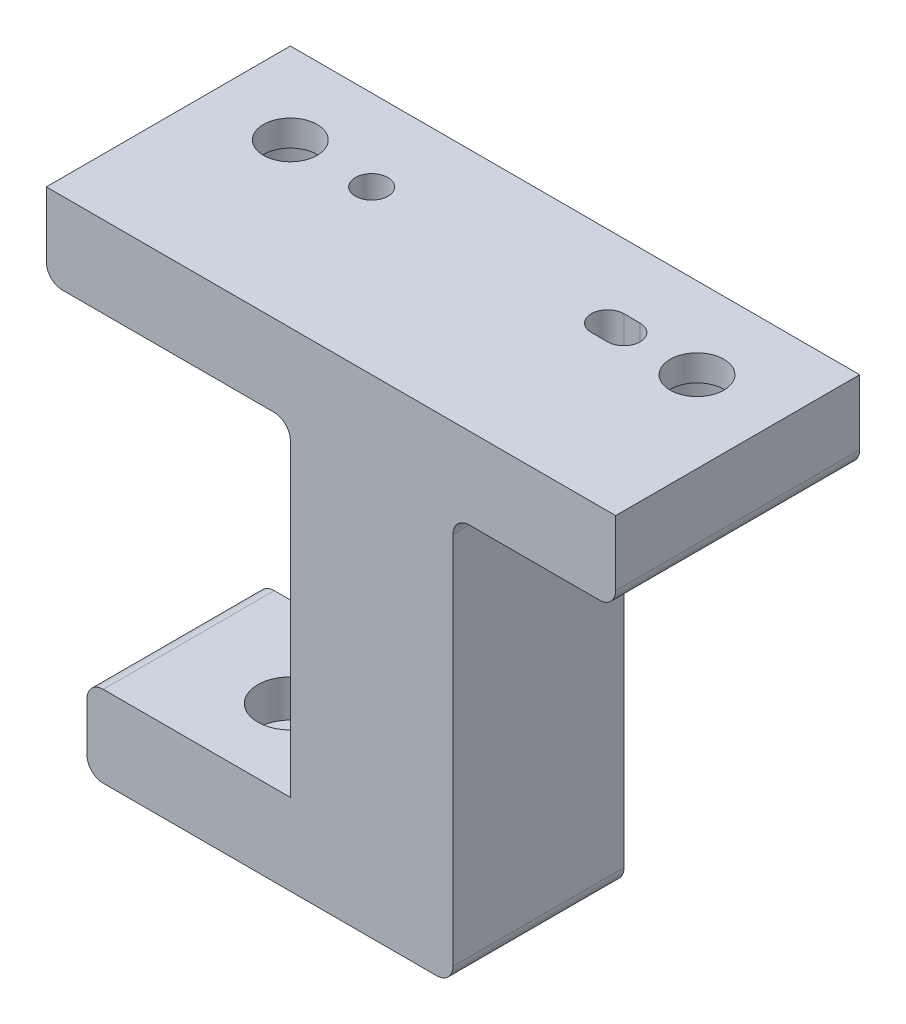
from build123d import *

# Parameters (mm, degrees)
SKETCH_8_W                = 70
SKETCH_8_H                = 30
EXTRUDE_3_DEPTH           = 60
SKETCH_9_W                = 30
SKETCH_9_H                = 40
SKETCH_9_W_2              = 20
CUT_EXTRUDE_3_DEPTH       = 83.758884896
OTHER_1_OUTLINE_R         = 5.5
OTHER_1_DEPTH             = 5
HOLE_WIZARD_2_D           = 4.5
HOLE_WIZARD_2_DEPTH       = 10
HOLE_WIZARD_2_CBORE_D     = 8
HOLE_WIZARD_2_CBORE_DEPTH = 4.6
BACK_REACH                = 85.4
SKETCH_16_W               = 70
SKETCH_16_H               = 8.975361008
MM_1_D                    = 4
MM_1_DEPTH                = 5
MM_1_TIP                  = 1.201721238
CUT_EXTRUDE_5_DEPTH       = 5
SKETCH_24_W               = 5
SKETCH_24_H               = 21.024638992
SKETCH_24_W_2             = 20
CUT_EXTRUDE_6_DEPTH       = 10
HOLE_WIZARD_3_D           = 6.6
HOLE_WIZARD_3_DEPTH       = 10
HOLE_WIZARD_3_CBORE_D     = 11
HOLE_WIZARD_3_CBORE_DEPTH = 6.8
FILLET_1_R                = 2
SKETCH_29_W               = 10
SKETCH_29_H               = 2
EXTRUDE_5_DEPTH           = 2.329281552
FILLET_3_R                = 2


# Read off the part's stored shape, not the designer's step: 孔1
with BuildPart() as part:
    # 草图8 → 凸台-拉伸3 (new body)
    with BuildSketch(Plane(origin=(0, 0, 0), x_dir=(1, 0, 0), z_dir=(0, 1, 0))):
        with Locations((13.466824006, -16.724598186)):
            Rectangle(SKETCH_8_W, SKETCH_8_H)
    extrude(amount=EXTRUDE_3_DEPTH)

    # 草图9 → 切除-拉伸3 (cut, through all)
    with BuildSketch(Plane.XY.offset(31.724598186)):
        with Locations((-6.533175994, 30)):
            Rectangle(SKETCH_9_W, SKETCH_9_H)
        with Locations((38.466824006, 30)):
            Rectangle(SKETCH_9_W_2, SKETCH_9_H)
    extrude(amount=-CUT_EXTRUDE_3_DEPTH, mode=Mode.SUBTRACT)

    # 孔1 outline → 孔1 (cut)
    with BuildSketch(Plane(origin=(0, 0, 0), x_dir=(1, 0, 0), z_dir=(0, 1, 0))):
        with Locations((-1.490630647, -21.665240746)):
            Circle(OTHER_1_OUTLINE_R)
    extrude(amount=OTHER_1_DEPTH, mode=Mode.SUBTRACT)

    # 打孔尺寸(%根据)内六角圆柱头螺钉的类型2
    with Locations(Plane(origin=(-1.533175994, 10, 21.724598186), x_dir=(1, 0, 0), z_dir=(0, 1, 0))):
        with Locations((0, 0)):
            CounterBoreHole(HOLE_WIZARD_2_D / 2, HOLE_WIZARD_2_CBORE_D / 2, HOLE_WIZARD_2_CBORE_DEPTH, depth=HOLE_WIZARD_2_DEPTH)

    # back: up to this face of the body (flat: up to its plane)
    back_end = Plane(part.part.faces().sort_by_distance((-6.533175994, 50, 16.724598186))[0])
    # 草图16 → back (cut, up to the picked face)
    with BuildSketch(Plane(origin=(0, 0, 0), x_dir=(1, 0, 0), z_dir=(0, 1, 0)), mode=Mode.PRIVATE) as back_sk1:
        with Locations((13.466824006, -6.21227869)):
            Rectangle(SKETCH_16_W, SKETCH_16_H)
    back_tool1 = split(extrude(back_sk1.sketch, amount=BACK_REACH, mode=Mode.PRIVATE), bisect_by=back_end, keep=Keep.BOTH, mode=Mode.PRIVATE)
    add(back_tool1.solids().sort_by(Axis((13.466824, 0, 6.212279), (0, 1, 0)))[0], mode=Mode.SUBTRACT)

    # 大小mm 暗销孔1
    with Locations(Plane(origin=(-1.533175994, 60, 11.724598186), x_dir=(0, 0, 1), z_dir=(0, 1, 0))):
        with Locations((0, 0)):
            Hole(MM_1_D / 2, depth=MM_1_DEPTH)
            with Locations((0, 0, -(MM_1_DEPTH + MM_1_TIP / 2))):  # 118° drill point
                Cone(0, MM_1_D / 2, MM_1_TIP, mode=Mode.SUBTRACT)

    # 草图23 → 切除-拉伸5 (cut)
    with BuildSketch(Plane.XZ.offset(-60)):
        with BuildLine():
            Line((29.466824006, 9.724598186), (27.466824006, 9.724598186))
            ThreePointArc((27.466824006, 9.724598186), (25.466824006, 11.724598186), (27.466824006, 13.724598186))
            Line((27.466824006, 13.724598186), (29.466824006, 13.724598186))
            ThreePointArc((29.466824006, 13.724598186), (31.466824006, 11.724598186), (29.466824006, 9.724598186))
        make_face()
    extrude(amount=CUT_EXTRUDE_5_DEPTH, mode=Mode.SUBTRACT)

    # 草图24 → 切除-拉伸6 (cut)
    with BuildSketch(Plane(origin=(0, 0, 0), x_dir=(1, 0, 0), z_dir=(0, 1, 0))):
        with Locations((-19.033175994, -21.21227869)):
            Rectangle(SKETCH_24_W, SKETCH_24_H)
        with Locations((38.466824006, -21.21227869)):
            Rectangle(SKETCH_24_W_2, SKETCH_24_H)
    extrude(amount=CUT_EXTRUDE_6_DEPTH, mode=Mode.SUBTRACT)

    # 打孔尺寸(%根据)内六角圆柱头螺钉的类型3
    with Locations(Plane(origin=(-11.533175994, 50, 11.724598186), x_dir=(0, 0, -1), z_dir=(0, -1, 0))):
        with Locations((0, 0), (0, 50)):
            CounterBoreHole(HOLE_WIZARD_3_D / 2, HOLE_WIZARD_3_CBORE_D / 2, HOLE_WIZARD_3_CBORE_DEPTH, depth=HOLE_WIZARD_3_DEPTH)

    # 圆角1
    fillet_1_edges = [part.edges().sort_by_distance(p)[0] for p in [
        (-16.533175994, 0, 21.21227869),
        (-16.533175994, 10, 21.21227869),
        (28.466824006, 0, 21.21227869),
        (-21.533175994, 50, 16.724598186),
        (48.466824006, 50, 16.724598186),
        (8.466824006, 50, 21.21227869),
        (28.466824006, 50, 21.21227869),
    ]]
    fillet(fillet_1_edges, radius=FILLET_1_R)

    # 草图29 → 凸台-拉伸5 (add)
    with BuildSketch(Plane(origin=(0, 0, 10.699959194), x_dir=(-1, 0, 0), z_dir=(0, 0, -1))):
        with Locations((0, -1)):
            Rectangle(SKETCH_29_W, SKETCH_29_H)
    extrude(amount=-EXTRUDE_5_DEPTH)

    # 圆角3
    fillet_3_edges = [part.edges().sort_by_distance(p)[0] for p in [
        (-5, -2, 11.86459997),
        (5, -2, 11.86459997),
    ]]
    fillet(fillet_3_edges, radius=FILLET_3_R - 0.0001)  # a hair under: the kernel refuses the full size


solid = part.part
